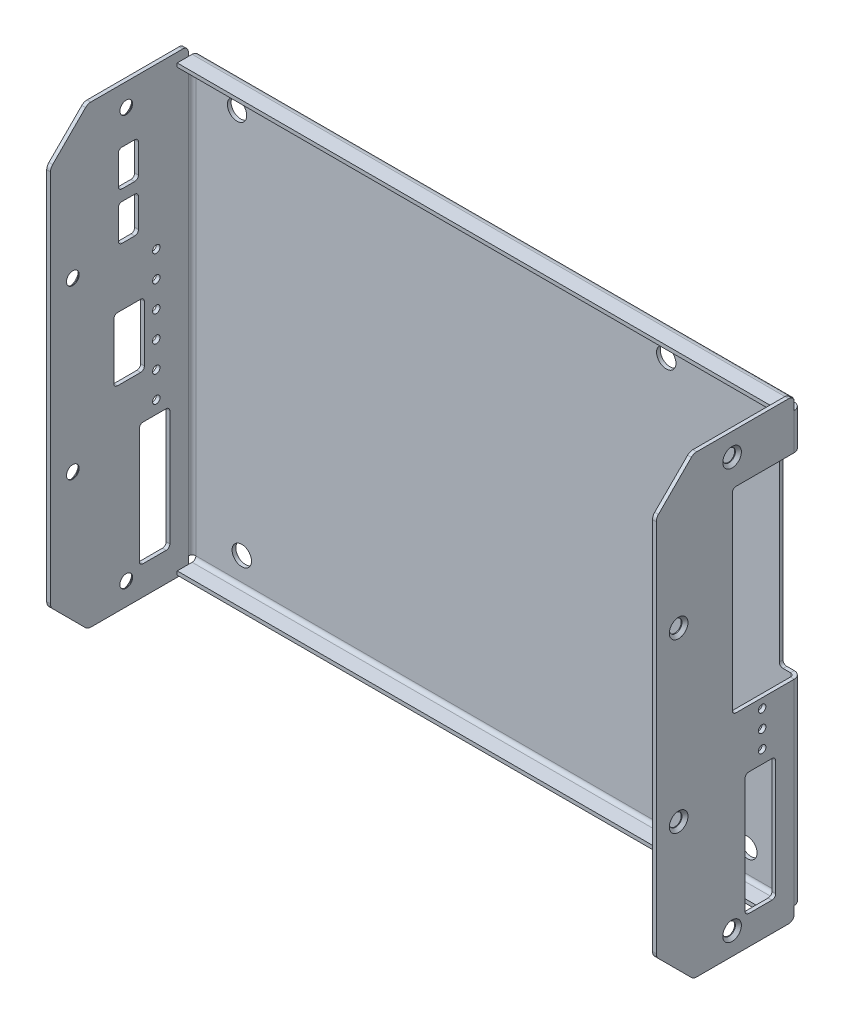
from build123d import *

# Parameters (mm, degrees)
SKETCH1_W                                      = 160.5
SKETCH1_H                                      = 119
BASE_FLANGE1_DEPTH                             = 1
EDGE_FLANGE1_STRIP_W                           = 6.5
EDGE_FLANGE1_STRIP_H                           = 1
EDGE_FLANGE1_STRIP_CUT_DEPTH                   = 119
EDGE_FLANGE1_STRIP_2_W                         = 6.5
EDGE_FLANGE1_STRIP_2_H                         = 1
EDGE_FLANGE1_STRIP_CUT_2_DEPTH                 = 119
EDGE_FLANGE1_DEPTH                             = 119
EDGE_FLANGE1_START                             = 1
EDGE_FLANGE1_FLAT_DEPTH                        = 1
EDGE_FLANGE1_BEND_DEPTH                        = 119
EDGE_FLANGE1_FLAT_2_DEPTH                      = 1
CSK_FOR_M3_FLAT_HEAD_MACHINE_SCREW2_AT_2_COUNT = 2
CSK_FOR_M3_FLAT_HEAD_MACHINE_SCREW2_AT_2_PITCH = 35.518358969
CSK_FOR_M3_FLAT_HEAD_MACHINE_SCREW2_AT_3_COUNT = 2
CSK_FOR_M3_FLAT_HEAD_MACHINE_SCREW2_AT_3_PITCH = 45
CSK_FOR_M3_FLAT_HEAD_MACHINE_SCREW2_AT_4_COUNT = 2
CSK_FOR_M3_FLAT_HEAD_MACHINE_SCREW2_AT_4_PITCH = 78.813411447
F_5_2_5_2_DIAMETER_HOLE1_D                     = 5.2
F_5_2_5_2_DIAMETER_HOLE1_DEPTH                 = 14
F_5_2_5_2_DIAMETER_HOLE1_TIP                   = 1.562237609
SKETCH17_R                                     = 1
SKETCH17_W                                     = 5.4
SKETCH17_H                                     = 9.7
SKETCH17_W_2                                   = 8.2
SKETCH17_H_2                                   = 17
CUT_EXTRUDE1_DEPTH                             = 1
FILLET1_R                                      = 1
EDGE_FLANGE2_START                             = -81.75
EDGE_FLANGE2_DEPTH                             = 163.5
EDGE_FLANGE2_2_DEPTH                           = 2
EDGE_FLANGE2_START_2                           = 79.75
EDGE_FLANGE2_3_DEPTH                           = 2
EDGE_FLANGE2_START_3                           = -79.75
EDGE_FLANGE2_4_DEPTH                           = 159.5
BREAK_CORNER1_START                            = -81.75
BREAK_CORNER1_DEPTH                            = 163.5
SKETCH28_R                                     = 1
SKETCH28_W                                     = 20.931529303
SKETCH28_H                                     = 52.6
CUT_EXTRUDE2_DEPTH                             = 5
BREAK_CORNER2_START                            = -1
BREAK_CORNER2_DEPTH                            = 1
BREAK_CORNER2_START_2                          = 80.75
BREAK_CORNER2_2_DEPTH                          = 1


# Read off the part's stored shape, not the designer's step: Edge-Flange2, Break-Corner1, Break-Corner2
# Sheet-metal steps are written as plain solids
with BuildPart() as part:
    # Sketch1 → Base-Flange1 (new body)
    with BuildSketch(Plane.XY):
        Rectangle(SKETCH1_W, SKETCH1_H)
    extrude(amount=-BASE_FLANGE1_DEPTH)

    # Edge-Flange1 strip (across the edge) → Edge-Flange1 strip cut (cut)
    with BuildSketch(Plane(origin=(-80.75, 59.5, 0), x_dir=(1, 0, 0), z_dir=(0, -1, 0))):
        with Locations((-2.25, -0.5)):
            Rectangle(EDGE_FLANGE1_STRIP_W, EDGE_FLANGE1_STRIP_H)
    extrude(amount=EDGE_FLANGE1_STRIP_CUT_DEPTH, mode=Mode.SUBTRACT)

    # Edge-Flange1 strip 2 (across the edge) → Edge-Flange1 strip cut 2 (cut)
    with BuildSketch(Plane(origin=(80.75, -59.5, 0), x_dir=(-1, 0, 0), z_dir=(0, 1, 0))):
        with Locations((-2.25, -0.5)):
            Rectangle(EDGE_FLANGE1_STRIP_2_W, EDGE_FLANGE1_STRIP_2_H)
    extrude(amount=EDGE_FLANGE1_STRIP_CUT_2_DEPTH, mode=Mode.SUBTRACT)

    # Edge-Flange1 bend section (across the edge) → Edge-Flange1 (add)
    with BuildSketch(Plane(origin=(-80.75, 59.5, 0), x_dir=(1, 0, 0), z_dir=(0, -1, 0))):
        with BuildLine():
            Line((-1, 1), (0, 1))
            ThreePointArc((0, 1), (0.292893219, 0.292893219), (1, 0))
            Line((1, 0), (1, -1))
            ThreePointArc((1, -1), (-0.414213562, -0.414213562), (-1, 1))
        make_face()
    extrude(amount=EDGE_FLANGE1_DEPTH)

    # Edge-Flange1 profile (on flange) → Edge-Flange1 flat (add)
    with BuildSketch(Plane(origin=(-80.75, 0, 0), x_dir=(0, -1, 0), z_dir=(-1, 0, 0)).offset(EDGE_FLANGE1_START)):
        with BuildLine():
            Line((-61, 27.171572875), (-61, 1))
            Line((-61, 1), (61, 1))
            Line((61, 1), (61, 27.171572875))
            ThreePointArc((61, 27.171572875), (60.847759065, 27.93693974), (60.414213562, 28.585786438))
            Line((60.414213562, 28.585786438), (51.585786438, 37.414213562))
            ThreePointArc((51.585786438, 37.414213562), (50.93693974, 37.847759065), (50.171572875, 38))
            Line((50.171572875, 38), (16, 38))
            Line((16, 38), (-16, 38))
            Line((-16, 38), (-50.171572875, 38))
            ThreePointArc((-50.171572875, 38), (-50.93693974, 37.847759065), (-51.585786438, 37.414213562))
            Line((-51.585786438, 37.414213562), (-60.414213562, 28.585786438))
            ThreePointArc((-60.414213562, 28.585786438), (-60.847759065, 27.93693974), (-61, 27.171572875))
        make_face()
    extrude(amount=-EDGE_FLANGE1_FLAT_DEPTH)

    # Edge-Flange1 bend section 2 (across the edge) → Edge-Flange1 bend (add)
    with BuildSketch(Plane(origin=(80.75, -59.5, 0), x_dir=(-1, 0, 0), z_dir=(0, 1, 0))):
        with BuildLine():
            Line((-1, 1), (0, 1))
            ThreePointArc((0, 1), (0.292893219, 0.292893219), (1, 0))
            Line((1, 0), (1, -1))
            ThreePointArc((1, -1), (-0.414213562, -0.414213562), (-1, 1))
        make_face()
    extrude(amount=EDGE_FLANGE1_BEND_DEPTH)

    # Edge-Flange1 profile 2 (on flange) → Edge-Flange1 flat 2 (add)
    with BuildSketch(Plane.YZ.offset(80.75).offset(EDGE_FLANGE1_START)):
        with BuildLine():
            ThreePointArc((-60.414213562, 28.585786438), (-60.847759065, 27.93693974), (-61, 27.171572875))
            Line((-61, 27.171572875), (-61, 1))
            Line((-61, 1), (61, 1))
            Line((61, 1), (61, 27.171572875))
            ThreePointArc((61, 27.171572875), (60.847759065, 27.93693974), (60.414213562, 28.585786438))
            Line((60.414213562, 28.585786438), (51.585786438, 37.414213562))
            ThreePointArc((51.585786438, 37.414213562), (50.93693974, 37.847759065), (50.171572875, 38))
            Line((50.171572875, 38), (16, 38))
            Line((16, 38), (-16, 38))
            Line((-16, 38), (-50.171572875, 38))
            ThreePointArc((-50.171572875, 38), (-50.93693974, 37.847759065), (-51.585786438, 37.414213562))
            Line((-51.585786438, 37.414213562), (-60.414213562, 28.585786438))
        make_face()
    extrude(amount=-EDGE_FLANGE1_FLAT_2_DEPTH)

    # Sketch11 → CSK for M3 Flat Head Machine Screw2 (revolve, cut)
    with BuildSketch(Plane(origin=(-81.75, 22.5, 32), x_dir=(0, 0, 1), z_dir=(0, 1, 0))):
        Polygon((0, 0), (0, 15.021463052), (1.7, 14), (1.7, 0.8), (2.5, 0), align=None)
    csk_for_m3_flat_head_machine_screw2 = revolve(axis=Axis((-88.1, 22.5, 32), (1, 0, 0)), mode=Mode.SUBTRACT)

    # CSK for M3 Flat Head Machine Screw2 at 2: CSK for M3 Flat Head Machine Screw2 ×2
    with Locations(*[Vector(1.4003459885704356e-15, 0.9150197515636448, -0.40340904086101714) * (i * CSK_FOR_M3_FLAT_HEAD_MACHINE_SCREW2_AT_2_PITCH) for i in range(1, CSK_FOR_M3_FLAT_HEAD_MACHINE_SCREW2_AT_2_COUNT)]):
        add(csk_for_m3_flat_head_machine_screw2, mode=Mode.SUBTRACT)

    # CSK for M3 Flat Head Machine Screw2 at 3: CSK for M3 Flat Head Machine Screw2 ×2
    with Locations(*[(0, -i * CSK_FOR_M3_FLAT_HEAD_MACHINE_SCREW2_AT_3_PITCH, 0) for i in range(1, CSK_FOR_M3_FLAT_HEAD_MACHINE_SCREW2_AT_3_COUNT)]):
        add(csk_for_m3_flat_head_machine_screw2, mode=Mode.SUBTRACT)

    # CSK for M3 Flat Head Machine Screw2 at 4: CSK for M3 Flat Head Machine Screw2 ×2
    with Locations(*[Vector(0, -0.9833351783331594, -0.18180188957349616) * (i * CSK_FOR_M3_FLAT_HEAD_MACHINE_SCREW2_AT_4_PITCH) for i in range(1, CSK_FOR_M3_FLAT_HEAD_MACHINE_SCREW2_AT_4_COUNT)]):
        add(csk_for_m3_flat_head_machine_screw2, mode=Mode.SUBTRACT)

    # Mirror1: CSK for M3 Flat Head Machine Screw2 across plane
    add(csk_for_m3_flat_head_machine_screw2.mirror(Plane(origin=(0, 0, 0), x_dir=(0, 0, 1), z_dir=(1, 0, 0))), mode=Mode.SUBTRACT)

    # Mirror1 copy 1 sketch → Mirror1 copy 1 (revolve, cut)
    with BuildSketch(Plane(origin=(81.75, 55, 17.671572875), x_dir=(0, 0, 1), z_dir=(0, 1, 0))):
        Polygon((0, 0), (0, -15.021463052), (1.7, -14), (1.7, -0.8), (2.5, 0), align=None)
    revolve(axis=Axis((88.1, 55, 17.671572875), (1, 0, 0)), mode=Mode.SUBTRACT)

    # Mirror1 copy 2 sketch → Mirror1 copy 2 (revolve, cut)
    with BuildSketch(Plane(origin=(81.75, -22.5, 32), x_dir=(0, 0, 1), z_dir=(0, 1, 0))):
        Polygon((0, 0), (0, -15.021463052), (1.7, -14), (1.7, -0.8), (2.5, 0), align=None)
    revolve(axis=Axis((88.1, -22.5, 32), (1, 0, 0)), mode=Mode.SUBTRACT)

    # Mirror1 copy 3 sketch → Mirror1 copy 3 (revolve, cut)
    with BuildSketch(Plane(origin=(81.75, -55, 17.671572875), x_dir=(0, 0, 1), z_dir=(0, 1, 0))):
        Polygon((0, 0), (0, -15.021463052), (1.7, -14), (1.7, -0.8), (2.5, 0), align=None)
    revolve(axis=Axis((88.1, -55, 17.671572875), (1, 0, 0)), mode=Mode.SUBTRACT)

    # Ø5.2 (5.2) Diameter Hole1
    with Locations(Plane(origin=(0, 0, -1), x_dir=(-1, 0, 0), z_dir=(0, 0, -1))):
        with Locations((67.43100124, -51.27700057), (-68.18584716, -51.27837217), (-46.42764836, 51.59299943), (68.70100124, 51.59299943)):
            Hole(F_5_2_5_2_DIAMETER_HOLE1_D / 2, depth=F_5_2_5_2_DIAMETER_HOLE1_DEPTH)
            with Locations((0, 0, -(F_5_2_5_2_DIAMETER_HOLE1_DEPTH + F_5_2_5_2_DIAMETER_HOLE1_TIP / 2))):  # 118° drill point
                Cone(0, F_5_2_5_2_DIAMETER_HOLE1_D / 2, F_5_2_5_2_DIAMETER_HOLE1_TIP, mode=Mode.SUBTRACT)

    # Sketch17 → Cut-Extrude1 (cut)
    with BuildSketch(Plane.ZY.offset(81.75)):
        with Locations((9.61148, -16.93699963)):
            Circle(SKETCH17_R)
        with Locations((9.61148, -9.93699963)):
            Circle(SKETCH17_R)
        with Locations((9.61148, -2.93699963)):
            Circle(SKETCH17_R)
        with Locations((9.61148, 4.06300037)):
            Circle(SKETCH17_R)
        with Locations((9.61148, 11.06300037)):
            Circle(SKETCH17_R)
        with Locations((9.61148, 18.06300037)):
            Circle(SKETCH17_R)
        with Locations((17.1, 41.5)):
            Rectangle(SKETCH17_W, SKETCH17_H)
        with Locations((16.9, 0)):
            Rectangle(SKETCH17_W_2, SKETCH17_H_2)
        Polygon((14.162732109, -53.24517671), (14.162732109, -20.353414123), (5.96148, -20.35341396), (5.96148, -53.245176873), align=None)
        with Locations((17.1, 28.85)):
            Rectangle(SKETCH17_W, SKETCH17_H)
    extrude(amount=-CUT_EXTRUDE1_DEPTH, mode=Mode.SUBTRACT)

    # Fillet1
    fillet1_edges = [part.edges().sort_by_distance(p)[0] for p in [
        (-81.25, 46.35, 19.8),
        (-81.25, 36.65, 19.8),
        (-81.25, 36.65, 14.4),
        (-81.25, 46.35, 14.4),
        (-81.25, 33.7, 14.4),
        (-81.25, 33.7, 19.8),
        (-81.25, 24, 19.8),
        (-81.25, 24, 14.4),
        (-81.25, -53.24517671, 14.162732109),
        (-81.25, -53.245176873, 5.96148),
        (-81.25, -20.35341396, 5.96148),
        (-81.25, -20.353414123, 14.162732109),
        (-81.25, -8.5, 21),
        (-81.25, -8.5, 12.8),
        (-81.25, 8.5, 12.8),
        (-81.25, 8.5, 21),
    ]]
    fillet(fillet1_edges, radius=FILLET1_R)

    # Edge-Flange2 outline → Edge-Flange2 (cut)
    with BuildSketch(Plane.YZ.offset(EDGE_FLANGE2_START)):
        with BuildLine():
            Line((-59.5, 1), (-59.5, -1))
            Line((-59.5, -1), (-57.5, -1))
            ThreePointArc((-57.5, -1), (-58.914213562, -0.414213562), (-59.5, 1))
        make_face()
        with BuildLine():
            Line((-57.5, 1), (-58.5, 1))
            ThreePointArc((-58.5, 1), (-58.207106781, 0.292893219), (-57.5, 0))
            Line((-57.5, 0), (-57.5, 1))
        make_face()
        with BuildLine():
            Line((57.5, 1), (57.5, 0))
            ThreePointArc((57.5, 0), (58.207106781, 0.292893219), (58.5, 1))
            Line((58.5, 1), (57.5, 1))
        make_face()
        with BuildLine():
            Line((57.5, -1), (59.5, -1))
            Line((59.5, -1), (59.5, 1))
            ThreePointArc((59.5, 1), (58.914213562, -0.414213562), (57.5, -1))
        make_face()
    extrude(amount=EDGE_FLANGE2_DEPTH, mode=Mode.SUBTRACT)

    # Edge-Flange2 2 outline → Edge-Flange2 2 (cut)
    with BuildSketch(Plane.YZ.offset(EDGE_FLANGE2_START)):
        with BuildLine():
            Line((-58.5, 1), (-59.5, 1))
            ThreePointArc((-59.5, 1), (-58.914213562, -0.414213562), (-57.5, -1))
            Line((-57.5, -1), (-57.5, 0))
            ThreePointArc((-57.5, 0), (-58.207106781, 0.292893219), (-58.5, 1))
        make_face()
        with BuildLine():
            ThreePointArc((57.5, -1), (58.914213562, -0.414213562), (59.5, 1))
            Line((59.5, 1), (58.5, 1))
            ThreePointArc((58.5, 1), (58.207106781, 0.292893219), (57.5, 0))
            Line((57.5, 0), (57.5, -1))
        make_face()
    extrude(amount=EDGE_FLANGE2_2_DEPTH, mode=Mode.SUBTRACT)

    # Edge-Flange2 3 outline → Edge-Flange2 3 (cut)
    with BuildSketch(Plane.YZ.offset(EDGE_FLANGE2_START_2)):
        with BuildLine():
            Line((-58.5, 1), (-59.5, 1))
            ThreePointArc((-59.5, 1), (-58.914213562, -0.414213562), (-57.5, -1))
            Line((-57.5, -1), (-57.5, 0))
            ThreePointArc((-57.5, 0), (-58.207106781, 0.292893219), (-58.5, 1))
        make_face()
        with BuildLine():
            ThreePointArc((57.5, -1), (58.914213562, -0.414213562), (59.5, 1))
            Line((59.5, 1), (58.5, 1))
            ThreePointArc((58.5, 1), (58.207106781, 0.292893219), (57.5, 0))
            Line((57.5, 0), (57.5, -1))
        make_face()
    extrude(amount=EDGE_FLANGE2_3_DEPTH, mode=Mode.SUBTRACT)

    # Edge-Flange2 4 outline → Edge-Flange2 4 (add)
    with BuildSketch(Plane.YZ.offset(EDGE_FLANGE2_START_3)):
        with BuildLine():
            Line((-59.5, 5), (-59.5, 1))
            ThreePointArc((-59.5, 1), (-59.431851652, 0.48236191), (-59.232050807, 0))
            Line((-59.232050807, 0), (-57.5, 0))
            ThreePointArc((-57.5, 0), (-58.207106781, 0.292893219), (-58.5, 1))
            Line((-58.5, 1), (-58.5, 5))
            Line((-58.5, 5), (-59.5, 5))
        make_face()
        with BuildLine():
            ThreePointArc((58.5, 1), (58.207106781, 0.292893219), (57.5, 0))
            Line((57.5, 0), (59.232050807, 0))
            ThreePointArc((59.232050807, 0), (59.431851652, 0.48236191), (59.5, 1))
            Line((59.5, 1), (59.5, 5))
            Line((59.5, 5), (58.5, 5))
            Line((58.5, 5), (58.5, 1))
        make_face()
    extrude(amount=EDGE_FLANGE2_4_DEPTH)

    # Break-Corner1 outline → Break-Corner1 (cut)
    with BuildSketch(Plane.YZ.offset(BREAK_CORNER1_START)):
        with BuildLine():
            ThreePointArc((-59.5, 1), (-60.560660172, 1.439339828), (-61, 2.5))
            Line((-61, 2.5), (-61, 1))
            Line((-61, 1), (-59.5, 1))
        make_face()
        with BuildLine():
            ThreePointArc((61, 2.5), (60.560660172, 1.439339828), (59.5, 1))
            Line((59.5, 1), (61, 1))
            Line((61, 1), (61, 2.5))
        make_face()
    extrude(amount=BREAK_CORNER1_DEPTH, mode=Mode.SUBTRACT)

    # Sketch28 → Cut-Extrude2 (cut)
    with BuildSketch(Plane(origin=(81.75, 0, 0), x_dir=(0, 0, -1), z_dir=(1, 0, 0))):
        with Locations((-9.6, -16.883414032)):
            Circle(SKETCH28_R)
        with Locations((-9.6, -12.153414032)):
            Circle(SKETCH28_R)
        with Locations((-9.6, -7.423414032)):
            Circle(SKETCH28_R)
        with BuildLine():
            Line((-13.162732128, -53.24517673), (-6.96148002, -53.245176853))
            ThreePointArc((-6.96148002, -53.245176853), (-6.254373226, -52.952283641), (-5.96148, -52.245176853))
            Line((-5.96148, -52.245176853), (-5.96148, -21.35341398))
            ThreePointArc((-5.96148, -21.35341398), (-6.254373226, -20.646307191), (-6.96148002, -20.35341398))
            Line((-6.96148002, -20.35341398), (-13.162732128, -20.353414103))
            ThreePointArc((-13.162732128, -20.353414103), (-13.869838897, -20.646307329), (-14.162732109, -21.353414103))
            Line((-14.162732109, -21.353414103), (-14.162732109, -52.24517673))
            ThreePointArc((-14.162732109, -52.24517673), (-13.869838897, -52.952283504), (-13.162732128, -53.24517673))
        make_face()
        with Locations((-7.145715348, 21.391709011)):
            Rectangle(SKETCH28_W, SKETCH28_H)
    extrude(amount=-CUT_EXTRUDE2_DEPTH, mode=Mode.SUBTRACT)

    # Break-Corner2 outline → Break-Corner2 (add)
    with BuildSketch(Plane.XY.offset(BREAK_CORNER2_START)):
        with BuildLine():
            Line((76.75, 47.691709011), (76.75, 46.691709011))
            ThreePointArc((76.75, 46.691709011), (77.042893219, 47.398815792), (77.75, 47.691709011))
            Line((77.75, 47.691709011), (76.75, 47.691709011))
        make_face()
        with BuildLine():
            ThreePointArc((77.75, -4.908290989), (77.042893218, -4.61539777), (76.75, -3.908290989))
            Line((76.75, -3.908290989), (76.75, -4.908290989))
            Line((76.75, -4.908290989), (77.75, -4.908290989))
        make_face()
    extrude(amount=BREAK_CORNER2_DEPTH)

    # Break-Corner2 2 outline → Break-Corner2 2 (add)
    with BuildSketch(Plane.YZ.offset(BREAK_CORNER2_START_2)):
        with BuildLine():
            Line((-4.908290989, 17.61148), (-4.908290989, 16.61148))
            ThreePointArc((-4.908290989, 16.61148), (-4.61539777, 17.318586781), (-3.908290989, 17.61148))
            Line((-3.908290989, 17.61148), (-4.908290989, 17.61148))
        make_face()
        with BuildLine():
            Line((47.691709011, 17.61148), (46.691709011, 17.61148))
            ThreePointArc((46.691709011, 17.61148), (47.398815792, 17.318586781), (47.691709011, 16.61148))
            Line((47.691709011, 16.61148), (47.691709011, 17.61148))
        make_face()
    extrude(amount=BREAK_CORNER2_2_DEPTH)


solid = part.part
